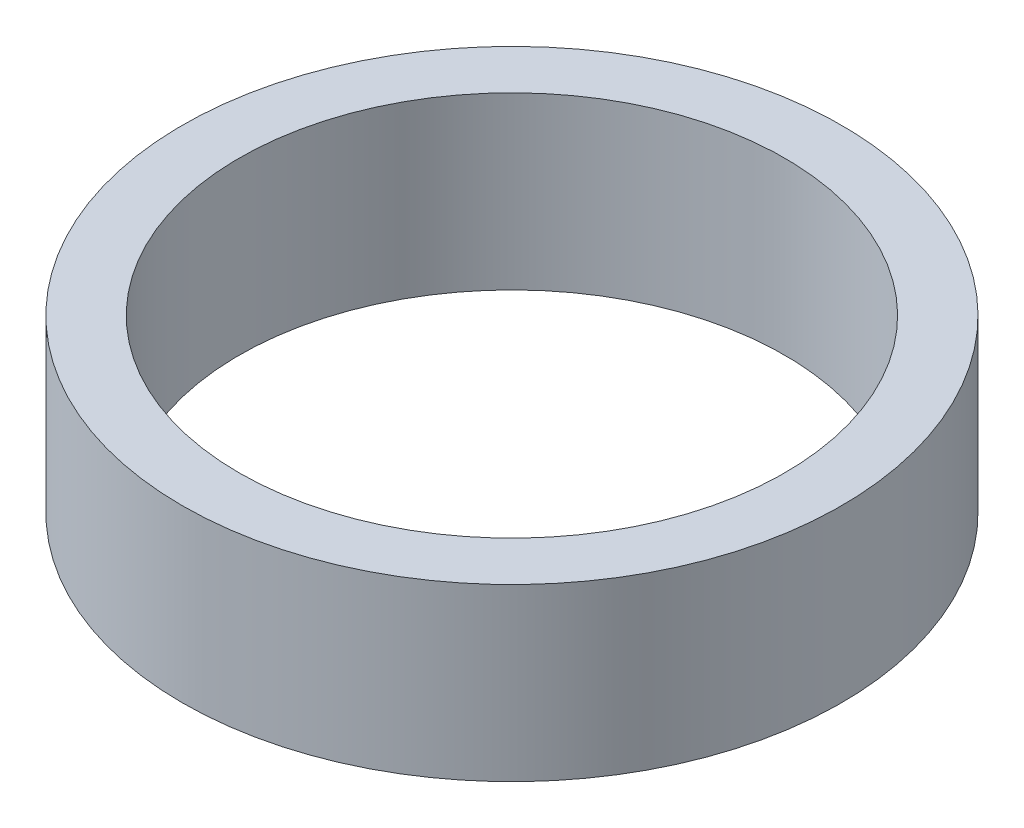
from build123d import *

# Parameters (mm, degrees)
SKETCH1_R           = 19.305
SKETCH1_R_2         = 15.975
BOSS_EXTRUDE1_DEPTH = 10


with BuildPart() as part:
    # Sketch1 → Boss-Extrude1 (new body)
    with BuildSketch(Plane(origin=(0, 0, 0), x_dir=(1, 0, 0), z_dir=(0, 1, 0))):
        Circle(SKETCH1_R)
        Circle(SKETCH1_R_2, mode=Mode.SUBTRACT)
    extrude(amount=BOSS_EXTRUDE1_DEPTH)


solid = part.part
